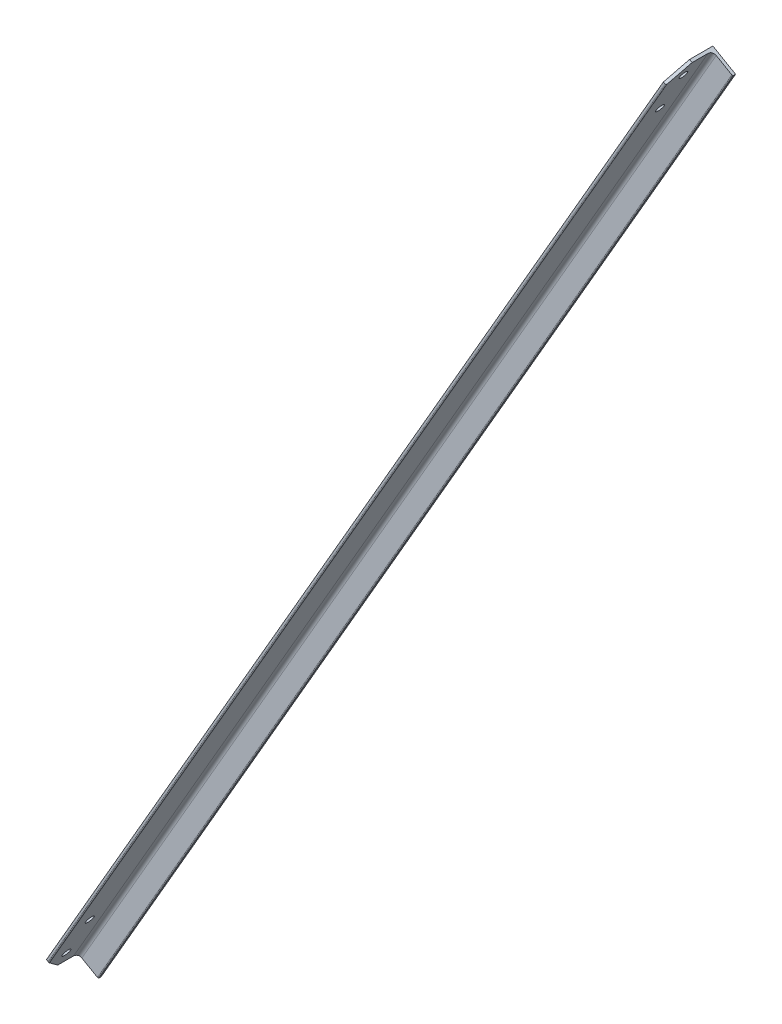
from build123d import *

# Parameters (mm, degrees)
F_70X45X5_1_DEPTH   = 2180
CUT_EXTRUDE_1_REACH = 2202.858
SKETCH_12_R         = 7
CUT_EXTRUDE_2_REACH = 2202.858
SKETCH_13_R         = 7
CHAMFER_1_SIZE      = 30
CHAMFER_2_SIZE      = 30


with BuildPart() as part:
    # 草图11 → 不等边角钢 70X45X5(1) (new body)
    with BuildSketch(Plane(origin=(1090, 1887.93538025, 0), x_dir=(0.86602540378444, -0.4999999999999978, 0), z_dir=(-0.4999999999999978, -0.86602540378444, 0))):
        with BuildLine():
            Line((0, 70), (0, 0))
            Line((0, 0), (45, 0))
            Line((45, 0), (45, 3.33))
            ThreePointArc((45, 3.33), (44.510868325, 4.510868325), (43.33, 5))
            Line((43.33, 5), (12.5, 5))
            ThreePointArc((12.5, 5), (7.196699141, 7.196699141), (5, 12.5))
            Line((5, 12.5), (5, 68.33))
            ThreePointArc((5, 68.33), (4.510868325, 69.510868325), (3.33, 70))
            Line((3.33, 70), (0, 70))
        make_face()
    extrude(amount=F_70X45X5_1_DEPTH)

    # 草图12 → 切除-拉伸1 (cut, up to next)
    with BuildSketch(Plane(origin=(0, 0, 0), x_dir=(0, 0, 1), z_dir=(-0.86602540378444, 0.49999999999999784, 0)), mode=Mode.PRIVATE) as cut_extrude_1_sk1:
        with Locations(Location((40, 30, 0), (0, 0, 270))):
            Circle(SKETCH_12_R)
    cut_extrude_1_tool1 = extrude(cut_extrude_1_sk1.sketch, amount=-CUT_EXTRUDE_1_REACH, mode=Mode.PRIVATE) & part.part
    # 草图12 → 切除-拉伸1 (cut, up to next)
    with BuildSketch(Plane(origin=(0, 0, 0), x_dir=(0, 0, 1), z_dir=(-0.86602540378444, 0.49999999999999784, 0)), mode=Mode.PRIVATE) as cut_extrude_1_sk2:
        with Locations(Location((40, 110, 0), (0, 0, 270))):
            Circle(SKETCH_12_R)
    cut_extrude_1_tool2 = extrude(cut_extrude_1_sk2.sketch, amount=-CUT_EXTRUDE_1_REACH, mode=Mode.PRIVATE) & part.part
    add(cut_extrude_1_tool1.solids().sort_by_distance((15, 25.980762, 40))[0], mode=Mode.SUBTRACT)
    add(cut_extrude_1_tool2.solids().sort_by_distance((55, 95.262794, 40))[0], mode=Mode.SUBTRACT)

    # 草图13 → 切除-拉伸2 (cut, up to next)
    with BuildSketch(Plane(origin=(0, 0, 0), x_dir=(0, 0, 1), z_dir=(-0.86602540378444, 0.49999999999999784, 0)), mode=Mode.PRIVATE) as cut_extrude_2_sk1:
        with Locations(Location((40.004723234, 2070, 0), (0, 0, 270))):
            Circle(SKETCH_13_R)
    cut_extrude_2_tool1 = extrude(cut_extrude_2_sk1.sketch, amount=-CUT_EXTRUDE_2_REACH, mode=Mode.PRIVATE) & part.part
    # 草图13 → 切除-拉伸2 (cut, up to next)
    with BuildSketch(Plane(origin=(0, 0, 0), x_dir=(0, 0, 1), z_dir=(-0.86602540378444, 0.49999999999999784, 0)), mode=Mode.PRIVATE) as cut_extrude_2_sk2:
        with Locations(Location((40.004723234, 2150, 0), (0, 0, 270))):
            Circle(SKETCH_13_R)
    cut_extrude_2_tool2 = extrude(cut_extrude_2_sk2.sketch, amount=-CUT_EXTRUDE_2_REACH, mode=Mode.PRIVATE) & part.part
    add(cut_extrude_2_tool1.solids().sort_by_distance((1035, 1792.672586, 40.004723))[0], mode=Mode.SUBTRACT)
    add(cut_extrude_2_tool2.solids().sort_by_distance((1075, 1861.954618, 40.004723))[0], mode=Mode.SUBTRACT)

    # 倒角1
    # the kernel refuses this chamfer: 30 mm, written as the material it takes off along each edge
    with BuildSketch(Plane(origin=(1159.698148536, 1847.695135431, 70), x_dir=(-0.4998109584556461, -0.8656979742248816, 0.027495876610586955), z_dir=(-0.86602540378444, 0.4999999999999978, 0))) as chamfer_1_piece_1:
        Polygon((CHAMFER_1_SIZE * 0.999621916911, -CHAMFER_1_SIZE * 0.0274958766106), (-CHAMFER_1_SIZE * 0.0274958766106, -CHAMFER_1_SIZE * 0.999621916911), (0, 0), align=None)
    extrude(amount=157.630979278, mode=Mode.SUBTRACT)

    # 倒角2
    # the kernel refuses this chamfer: 30 mm, written as the material it takes off along each edge
    with BuildSketch(Plane(origin=(69.698148536, -40.240244819, 70), x_dir=(-0.013747938305293052, -0.02381212764409008, -0.9996219169112966), z_dir=(-0.86602540378444, 0.4999999999999978, 0))) as chamfer_2_piece_1:
        Polygon((CHAMFER_2_SIZE * 0.999621916911, -CHAMFER_2_SIZE * 0.0274958766106), (-CHAMFER_2_SIZE * 0.0274958766106, -CHAMFER_2_SIZE * 0.999621916911), (0, 0), align=None)
    extrude(amount=157.630979278, mode=Mode.SUBTRACT)


solid = part.part
